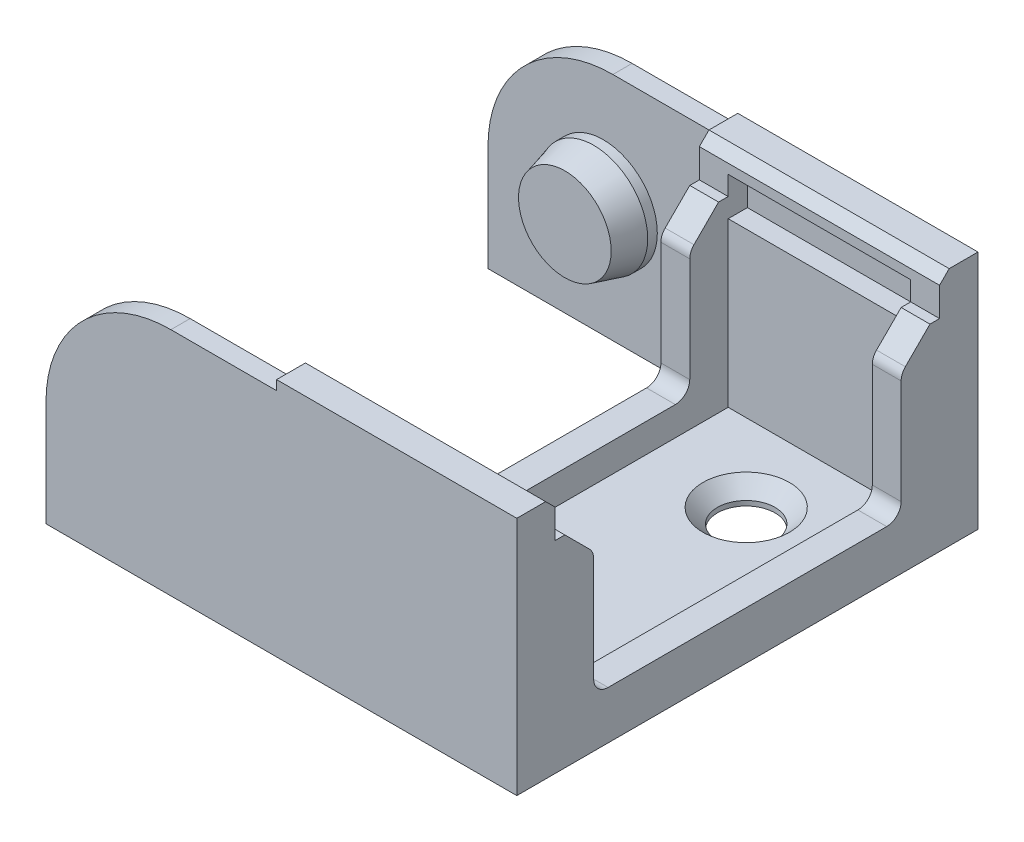
from build123d import *

# Parameters (mm, degrees)
SKETCH_1_W             = 25
SKETCH_1_H             = 25
EXTRUDE_1_DEPTH        = 4
SKETCH_2_W             = 24
SKETCH_2_H             = 24
EXTRUDE_2_DEPTH        = 2
SKETCH_3_R             = 5.625
EXTRUDE_3_DEPTH        = 4
CHAMFER_1_SIZE         = 3
CHAMFER_1_SIZE2        = 0.803847577
EXTRUDE_4_DEPTH        = 2
SKETCH_6_R             = 5
CUT_EXTRUDE_2_DEPTH    = 10
EXTRUDE_6_DEPTH        = 20
SKETCH_9_W             = 19
SKETCH_9_H             = 3
CUT_EXTRUDE_4_DEPTH    = 2
CHAMFER_2_SIZE         = 1
CHAMFER_3_SIZE         = 3.732050808
CHAMFER_3_SIZE_2       = 1
FILLET_1_R             = 13
CHAMFER_4_SIZE         = 1
SKETCH_11_W            = 3
SKETCH_11_H            = 4
EXTRUDE_7_DEPTH        = 16
PATTERN_LINEAR_1_COUNT = 2
PATTERN_LINEAR_1_PITCH = 22
CHAMFER_6_SIZE         = 3
FILLET_2_R             = 1.5
SKETCH_13_W            = 40.293086247
SKETCH_13_H            = 27.591529789
CUT_EXTRUDE_6_DEPTH    = 100
SKETCH_14_R            = 3
CUT_EXTRUDE_7_DEPTH    = 100
CHAMFER_7_SIZE         = 1.5


with BuildPart() as part:
    # Эскиз1 → Бобышка-Вытянуть1 (new body)
    with BuildSketch(Plane.XY):
        with Locations((-26.279531703, 11.219512195)):
            Rectangle(SKETCH_1_W, SKETCH_1_H)
    extrude(amount=EXTRUDE_1_DEPTH)

    # Эскиз2 → Бобышка-Вытянуть2 (add)
    with BuildSketch(Plane(origin=(0, 0, 0), x_dir=(-1, 0, 0), z_dir=(0, 0, -1))):
        with Locations((50.779531703, 10.719512195)):
            Rectangle(SKETCH_2_W, SKETCH_2_H)
    extrude(amount=-EXTRUDE_2_DEPTH)

    # Эскиз3 → Бобышка-Вытянуть3 (add)
    with BuildSketch(Plane.XY.offset(2)):
        with Locations((-50.779531703, 10.719512195)):
            Circle(SKETCH_3_R)
    extrude(amount=EXTRUDE_3_DEPTH)

    # Фаска1
    chamfer_1_edges = [part.edges().sort_by_distance(p)[0] for p in [
        (-56.404531703, 10.719512195, 6),
    ]]
    chamfer_1_side = [part.faces().sort_by_distance(p)[0] for p in [
        (-56.404531703, 10.719512195, 4),
    ]]
    chamfer(chamfer_1_edges, length=CHAMFER_1_SIZE, length2=CHAMFER_1_SIZE2, reference=chamfer_1_side[0])

    # Эскиз5 → Бобышка-Вытянуть4 (add)
    with BuildSketch(Plane.XY.offset(4)):
        with BuildLine():
            Line((-18.981970926, 22.719512195), (-0.779531703, 22.719512195))
            ThreePointArc((-0.779531703, 22.719512195), (11.220468297, 10.719512195), (-0.779531703, -1.280487805))
            Line((-0.779531703, -1.280487805), (-18.981970926, -1.280487805))
            ThreePointArc((-18.981970926, -1.280487805), (-30.981970926, 10.719512195), (-18.981970926, 22.719512195))
        make_face()
    extrude(amount=-EXTRUDE_4_DEPTH)

    # Эскиз6 → Вырез-Вытянуть2 (cut)
    with BuildSketch(Plane(origin=(0, 0, 2), x_dir=(-1, 0, 0), z_dir=(0, 0, -1))):
        with Locations((0.779531703, 10.719512195)):
            Circle(SKETCH_6_R)
    extrude(amount=-CUT_EXTRUDE_2_DEPTH, mode=Mode.SUBTRACT)

    # Эскиз8 → Бобышка-Вытянуть6 (add)
    with BuildSketch(Plane.XY.offset(4)):
        Polygon((-38.779531703, 3.719512195), (-35.779531703, 3.719512195), (-35.779531703, 0.719512195), (-16.779531703, 0.719512195), (-16.779531703, 3.719512195), (-13.779531703, 3.719512195), (-13.779531703, -1.280487805), (-38.779531703, -1.280487805), align=None)
    extrude(amount=EXTRUDE_6_DEPTH)

    # Эскиз9 → Вырез-Вытянуть4 (cut)
    with BuildSketch(Plane.XY.offset(4)):
        with Locations((-26.279531703, 19.219512195)):
            Rectangle(SKETCH_9_W, SKETCH_9_H)
    extrude(amount=-CUT_EXTRUDE_4_DEPTH, mode=Mode.SUBTRACT)

    # Фаска2
    chamfer_2_edges = [part.edges().sort_by_distance(p)[0] for p in [
        (-26.279531703, 20.719512195, 4),
    ]]
    chamfer(chamfer_2_edges, length=CHAMFER_2_SIZE)

    # Фаска3
    # the kernel refuses this chamfer: 3.732050808, 1 mm, written as the material it takes off along each edge
    with BuildSketch(Plane(origin=(-0.779531703, 10.719512195, 2), x_dir=(-1, 0, 0), z_dir=(0, -1, 0))) as chamfer_3_piece_1:
        Polygon((5, -CHAMFER_3_SIZE), (5 + CHAMFER_3_SIZE_2, 0), (5, 0), align=None)
    revolve(axis=Axis((-0.779531703, 10.719512195, 2), (0, 0, -1)), mode=Mode.SUBTRACT)

    # Скругление1
    fillet_1_edges = [part.edges().sort_by_distance(p)[0] for p in [
        (-62.779531703, 22.719512195, 1),
    ]]
    fillet(fillet_1_edges, radius=FILLET_1_R)

    # Фаска4
    chamfer_4_edges = [part.edges().sort_by_distance(p)[0] for p in [
        (-26.279531703, 23.719512195, 4),
    ]]
    chamfer(chamfer_4_edges, length=CHAMFER_4_SIZE)

    # Эскиз11 → Бобышка-Вытянуть7 (add)
    with BuildSketch(Plane(origin=(0, 3.719512195, 0), x_dir=(1, 0, 0), z_dir=(0, 1, 0))):
        with Locations((-37.279531703, -6)):
            Rectangle(SKETCH_11_W, SKETCH_11_H)
    extrude_7 = extrude(amount=EXTRUDE_7_DEPTH)

    # Линейный массив1: Бобышка-Вытянуть7 ×2
    with Locations(*[(i * PATTERN_LINEAR_1_PITCH, 0, 0) for i in range(1, PATTERN_LINEAR_1_COUNT)]):
        add(extrude_7)

    # Фаска6
    chamfer_6_edges = [part.edges().sort_by_distance(p)[0] for p in [
        (-37.279531703, 19.719512195, 8),
        (-15.279531703, 19.719512195, 8),
    ]]
    chamfer(chamfer_6_edges, length=CHAMFER_6_SIZE)

    # Скругление2
    fillet_2_edges = [part.edges().sort_by_distance(p)[0] for p in [
        (-37.279531703, 3.719512195, 8),
        (-15.279531703, 3.719512195, 8),
        (-15.279531703, 16.719512195, 8),
        (-37.279531703, 16.719512195, 8),
    ]]
    fillet(fillet_2_edges, radius=FILLET_2_R)

    # Эскиз13 → Вырез-Вытянуть6 (cut)
    with BuildSketch(Plane.XY.offset(4)):
        with Locations((6.36701142, 8.923747301)):
            Rectangle(SKETCH_13_W, SKETCH_13_H)
    extrude(amount=-CUT_EXTRUDE_6_DEPTH, mode=Mode.SUBTRACT)

    # Эскиз14 → Вырез-Вытянуть7 (cut)
    with BuildSketch(Plane(origin=(0, 0.719512195, 0), x_dir=(1, 0, 0), z_dir=(0, 1, 0))):
        with Locations(Location((-25.824324294, -12.079681064, 0), (0, 0, 270))):
            Circle(SKETCH_14_R)
    extrude(amount=-CUT_EXTRUDE_7_DEPTH, mode=Mode.SUBTRACT)

    # Фаска7
    chamfer_7_edges = [part.edges().sort_by_distance(p)[0] for p in [
        (-25.824324294, 0.719512195, 9.079681064),
    ]]
    chamfer(chamfer_7_edges, length=CHAMFER_7_SIZE)

    # Зеркальное отражение1: part across plane


with BuildPart() as part_1:
    add(part.part)
    add(part.part.mirror(Plane(origin=(0, 0, 24), x_dir=(1, 0, 0), z_dir=(0, 0, -1))))


solid = part_1.part
